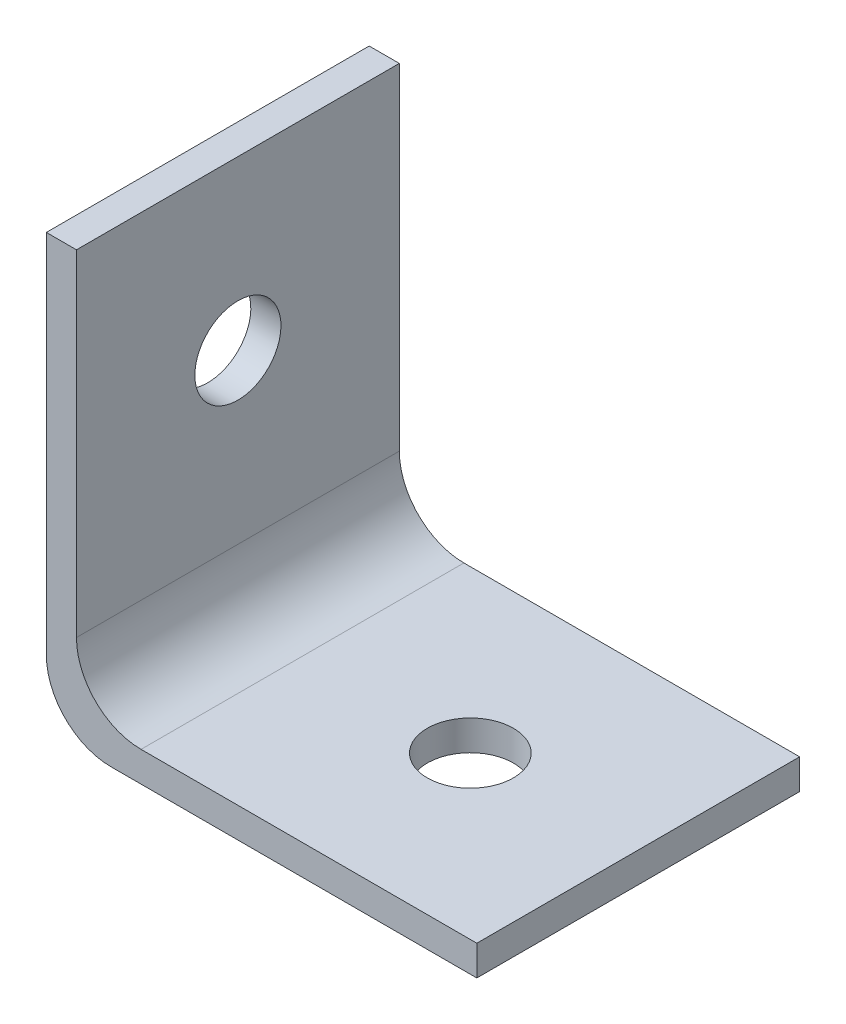
from build123d import *

# Parameters (mm, degrees)
BOSS_EXTRUDE1_DEPTH = 15
SKETCH2_R           = 2
CUT_EXTRUDE1_DEPTH  = 32.160231065
SKETCH3_R           = 2
CUT_EXTRUDE2_DEPTH  = 32.160231065


with BuildPart() as part:
    # Sketch1 → Boss-Extrude1 (new body)
    with BuildSketch(Plane.XY):
        with BuildLine():
            Line((0, 3), (0, 20))
            Line((0, 20), (1.4, 20))
            Line((1.4, 20), (1.4, 4.4))
            ThreePointArc((1.4, 4.4), (2.278679656, 2.278679656), (4.4, 1.4))
            Line((4.4, 1.4), (20, 1.4))
            Line((20, 1.4), (20, 0))
            Line((20, 0), (3, 0))
            ThreePointArc((3, 0), (0.878679656, 0.878679656), (0, 3))
        make_face()
    extrude(amount=BOSS_EXTRUDE1_DEPTH)

    # Sketch2 → Cut-Extrude1 (cut, through all)
    with BuildSketch(Plane(origin=(0, 1.4, 0), x_dir=(1, 0, 0), z_dir=(0, 1, 0))):
        with Locations((12.2, -7.5)):
            Circle(SKETCH2_R)
    extrude(amount=-CUT_EXTRUDE1_DEPTH, mode=Mode.SUBTRACT)

    # Sketch3 → Cut-Extrude2 (cut, through all)
    with BuildSketch(Plane(origin=(1.4, 0, 0), x_dir=(0, 0, -1), z_dir=(1, 0, 0))):
        with Locations((-7.5, 12.2)):
            Circle(SKETCH3_R)
    extrude(amount=-CUT_EXTRUDE2_DEPTH, mode=Mode.SUBTRACT)


solid = part.part
